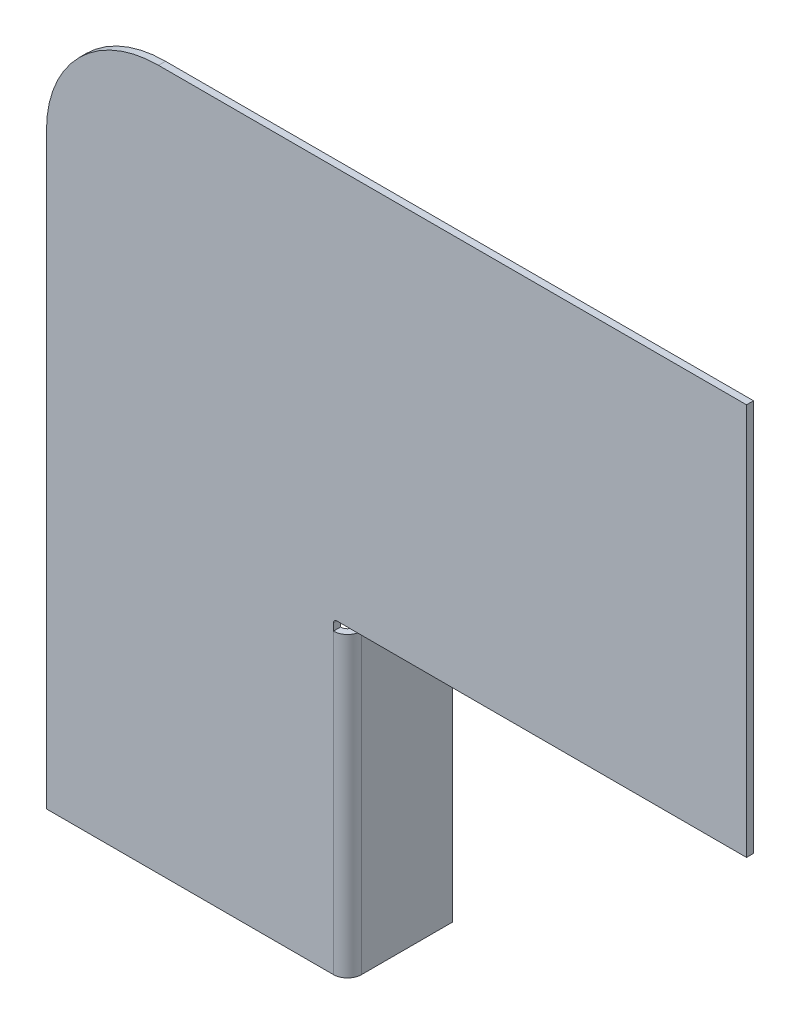
from build123d import *

# Parameters (mm, degrees)
BASE_FLANGE1_DEPTH = 1
EDGE_FLANGE2_DEPTH = 42.5


# Sheet-metal steps are written as plain solids
with BuildPart() as part:
    # Sketch1 → Base-Flange1 (new body)
    with BuildSketch(Plane.XY):
        with BuildLine():
            Line((-16, 0), (-16, -84))
            Line((-16, -84), (25, -84))
            Line((25, -84), (25, -40.5))
            ThreePointArc((25, -40.5), (25.146446609, -40.146446609), (25.5, -40))
            Line((25.5, -40), (84, -40))
            Line((84, -40), (84, 16))
            Line((84, 16), (0, 16))
            ThreePointArc((0, 16), (-11.313708499, 11.313708499), (-16, 0))
        make_face()
    extrude(amount=-BASE_FLANGE1_DEPTH)

    # Edge-Flange2 section (across the edge) → Edge-Flange2 (add)
    with BuildSketch(Plane(origin=(26, -41.5, -1), x_dir=(-1, 0, 0), z_dir=(0, -1, 0))):
        with BuildLine():
            Line((-1, 1), (-1, 14))
            Line((-1, 14), (0, 14))
            Line((0, 14), (0, 1))
            ThreePointArc((0, 1), (0.292893219, 0.292893219), (1, 0))
            Line((1, 0), (1, -1))
            ThreePointArc((1, -1), (-0.414213562, -0.414213562), (-1, 1))
        make_face()
    extrude(amount=EDGE_FLANGE2_DEPTH)


solid = part.part
